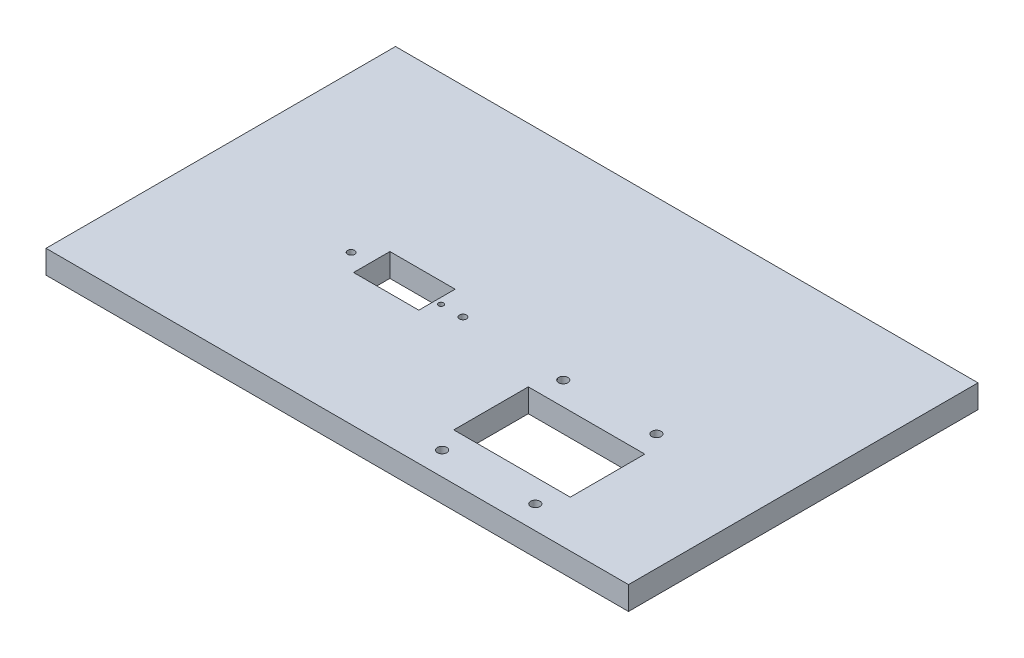
from build123d import *

# Parameters (mm, degrees)
SKETCH2_W           = 250
SKETCH2_H           = 150
BOSS_EXTRUDE1_DEPTH = 10
SKETCH3_R           = 2
SKETCH3_W           = 50
SKETCH3_H           = 32
CUT_EXTRUDE1_DEPTH  = 10
SKETCH4_W           = 28
SKETCH4_H           = 15.597165116
CUT_EXTRUDE2_DEPTH  = 10
SKETCH6_R           = 1.1
CUT_EXTRUDE3_DEPTH  = 10
SKETCH7_R           = 1.5
CUT_EXTRUDE4_DEPTH  = 10


with BuildPart() as part:
    # Sketch2 → Boss-Extrude1 (new body)
    with BuildSketch(Plane(origin=(0, 0, 0), x_dir=(1, 0, 0), z_dir=(0, 1, 0))):
        Rectangle(SKETCH2_W, SKETCH2_H)
    extrude(amount=BOSS_EXTRUDE1_DEPTH)

    # Sketch3 → Cut-Extrude1 (cut)
    with BuildSketch(Plane(origin=(0, 10, 0), x_dir=(1, 0, 0), z_dir=(0, 1, 0))):
        with Locations((35, -13)):
            Circle(SKETCH3_R)
        with Locations((75, -13)):
            Circle(SKETCH3_R)
        with Locations((35, -65)):
            Circle(SKETCH3_R)
        with Locations((75, -65)):
            Circle(SKETCH3_R)
        with Locations((55, -39)):
            Rectangle(SKETCH3_W, SKETCH3_H)
    extrude(amount=-CUT_EXTRUDE1_DEPTH, mode=Mode.SUBTRACT)

    # Sketch4 → Cut-Extrude2 (cut)
    with BuildSketch(Plane(origin=(0, 10, 0), x_dir=(1, 0, 0), z_dir=(0, 1, 0))):
        with Locations((-36, -10.201417442)):
            Rectangle(SKETCH4_W, SKETCH4_H)
    extrude(amount=-CUT_EXTRUDE2_DEPTH, mode=Mode.SUBTRACT)

    # Sketch6 → Cut-Extrude3 (cut)
    with BuildSketch(Plane(origin=(0, 10, 0), x_dir=(1, 0, 0), z_dir=(0, 1, 0))):
        with Locations((-19.4, -11.05)):
            Circle(SKETCH6_R)
        with Locations((-47.1, -11.05)):
            Circle(SKETCH6_R)
    extrude(amount=-CUT_EXTRUDE3_DEPTH, mode=Mode.SUBTRACT)

    # Sketch7 → Cut-Extrude4 (cut)
    with BuildSketch(Plane(origin=(0, 10, 0), x_dir=(1, 0, 0), z_dir=(0, 1, 0))):
        with Locations((-10, -11.05)):
            Circle(SKETCH7_R)
        with Locations((-58, -11.05)):
            Circle(SKETCH7_R)
    extrude(amount=-CUT_EXTRUDE4_DEPTH, mode=Mode.SUBTRACT)


solid = part.part
